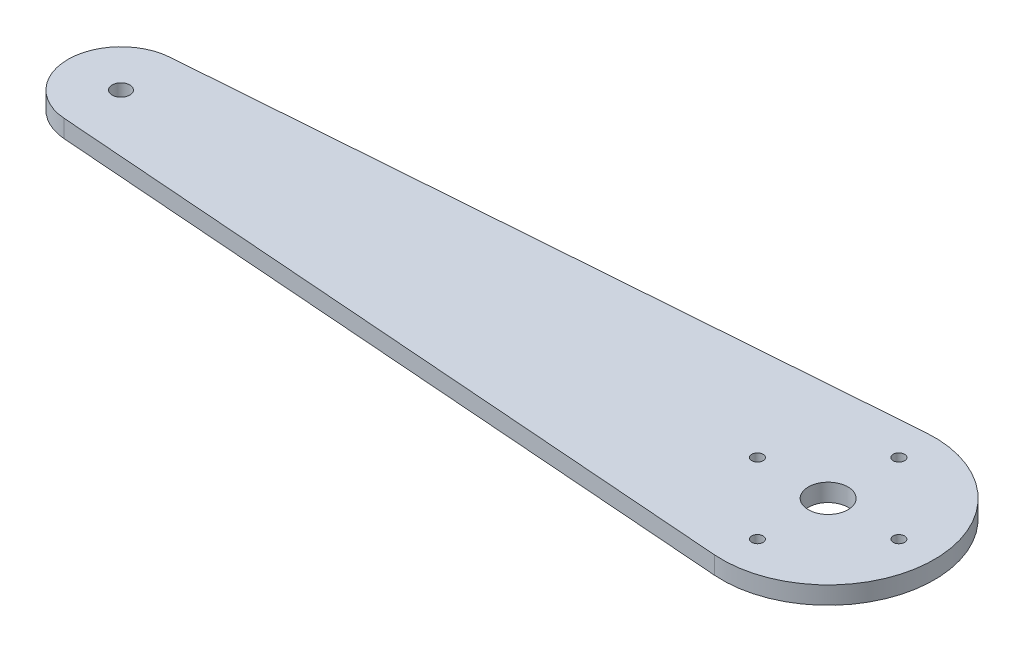
from build123d import *

# Parameters (mm, degrees)
SKETCH1_R           = 1.5875
SKETCH1_R_2         = 3.556
SKETCH1_R_3         = 1.016
BOSS_EXTRUDE1_DEPTH = 3.175


with BuildPart() as part:
    # Sketch1 → Boss-Extrude1 (new body)
    with BuildSketch(Plane(origin=(0, 0, 0), x_dir=(1, 0, 0), z_dir=(0, 1, 0))):
        with BuildLine():
            Line((-127.714375, 9.498173159), (-1.42875, 18.996346318))
            ThreePointArc((-1.42875, 18.996346318), (19.05, 0), (-1.42875, -18.996346318))
            Line((-1.42875, -18.996346318), (-127.714375, -9.498173159))
            ThreePointArc((-127.714375, -9.498173159), (-136.525, 0), (-127.714375, 9.498173159))
        make_face()
        with Locations((-127, 0)):
            Circle(SKETCH1_R, mode=Mode.SUBTRACT)
        Circle(SKETCH1_R_2, mode=Mode.SUBTRACT)
        with Locations((0, 12.7)):
            Circle(SKETCH1_R_3, mode=Mode.SUBTRACT)
        with Locations((12.7, 0)):
            Circle(SKETCH1_R_3, mode=Mode.SUBTRACT)
        with Locations((0, -12.7)):
            Circle(SKETCH1_R_3, mode=Mode.SUBTRACT)
        with Locations((-12.7, 0)):
            Circle(SKETCH1_R_3, mode=Mode.SUBTRACT)
    extrude(amount=BOSS_EXTRUDE1_DEPTH)


solid = part.part
